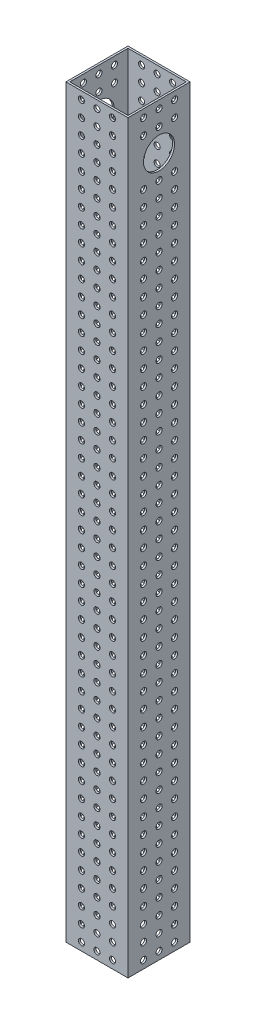
from build123d import *

# Parameters (mm, degrees)
SKETCH1_W           = 50.8
SKETCH1_H           = 50.8
SKETCH1_W_2         = 47.625
SKETCH1_H_2         = 47.625
BOSS_EXTRUDE1_DEPTH = 685.8
SKETCH2_R           = 2.4892
CUT_EXTRUDE1_DEPTH  = 689.147832955
SKETCH4_R           = 2.4892
CUT_EXTRUDE2_DEPTH  = 689.147832955
SKETCH5_W           = 50.8
SKETCH5_H           = 76.2
CUT_EXTRUDE3_DEPTH  = 689.147832955
SKETCH6_R           = 12.7
CUT_EXTRUDE4_DEPTH  = 613.240116294


with BuildPart() as part:
    # Sketch1 → Boss-Extrude1 (new body)
    with BuildSketch(Plane(origin=(0, 0, 0), x_dir=(1, 0, 0), z_dir=(0, 1, 0))):
        Rectangle(SKETCH1_W, SKETCH1_H)
        Rectangle(SKETCH1_W_2, SKETCH1_H_2, mode=Mode.SUBTRACT)
    extrude(amount=BOSS_EXTRUDE1_DEPTH)

    # Sketch2 → Cut-Extrude1 (cut, through all)
    with BuildSketch(Plane.XY.offset(25.4)):
        with Locations((-12.7, 679.45)):
            Circle(SKETCH2_R)
        with Locations((-12.7, 666.75)):
            Circle(SKETCH2_R)
        with Locations((-12.7, 654.05)):
            Circle(SKETCH2_R)
        with Locations((-12.7, 641.35)):
            Circle(SKETCH2_R)
        with Locations((-12.7, 628.65)):
            Circle(SKETCH2_R)
        with Locations((-12.7, 615.95)):
            Circle(SKETCH2_R)
        with Locations((-12.7, 603.25)):
            Circle(SKETCH2_R)
        with Locations((-12.7, 590.55)):
            Circle(SKETCH2_R)
        with Locations((-12.7, 577.85)):
            Circle(SKETCH2_R)
        with Locations((-12.7, 565.15)):
            Circle(SKETCH2_R)
        with Locations((-12.7, 552.45)):
            Circle(SKETCH2_R)
        with Locations((-12.7, 539.75)):
            Circle(SKETCH2_R)
        with Locations((-12.7, 527.05)):
            Circle(SKETCH2_R)
        with Locations((-12.7, 514.35)):
            Circle(SKETCH2_R)
        with Locations((-12.7, 501.65)):
            Circle(SKETCH2_R)
        with Locations((-12.7, 488.95)):
            Circle(SKETCH2_R)
        with Locations((-12.7, 476.25)):
            Circle(SKETCH2_R)
        with Locations((-12.7, 463.55)):
            Circle(SKETCH2_R)
        with Locations((-12.7, 450.85)):
            Circle(SKETCH2_R)
        with Locations((-12.7, 438.15)):
            Circle(SKETCH2_R)
        with Locations((-12.7, 425.45)):
            Circle(SKETCH2_R)
        with Locations((-12.7, 412.75)):
            Circle(SKETCH2_R)
        with Locations((-12.7, 400.05)):
            Circle(SKETCH2_R)
        with Locations((-12.7, 387.35)):
            Circle(SKETCH2_R)
        with Locations((-12.7, 374.65)):
            Circle(SKETCH2_R)
        with Locations((-12.7, 361.95)):
            Circle(SKETCH2_R)
        with Locations((-12.7, 349.25)):
            Circle(SKETCH2_R)
        with Locations((-12.7, 336.55)):
            Circle(SKETCH2_R)
        with Locations((-12.7, 323.85)):
            Circle(SKETCH2_R)
        with Locations((-12.7, 311.15)):
            Circle(SKETCH2_R)
        with Locations((-12.7, 298.45)):
            Circle(SKETCH2_R)
        with Locations((-12.7, 285.75)):
            Circle(SKETCH2_R)
        with Locations((-12.7, 273.05)):
            Circle(SKETCH2_R)
        with Locations((-12.7, 260.35)):
            Circle(SKETCH2_R)
        with Locations((-12.7, 247.65)):
            Circle(SKETCH2_R)
        with Locations((-12.7, 234.95)):
            Circle(SKETCH2_R)
        with Locations((-12.7, 222.25)):
            Circle(SKETCH2_R)
        with Locations((-12.7, 209.55)):
            Circle(SKETCH2_R)
        with Locations((-12.7, 196.85)):
            Circle(SKETCH2_R)
        with Locations((-12.7, 184.15)):
            Circle(SKETCH2_R)
        with Locations((-12.7, 171.45)):
            Circle(SKETCH2_R)
        with Locations((-12.7, 158.75)):
            Circle(SKETCH2_R)
        with Locations((-12.7, 146.05)):
            Circle(SKETCH2_R)
        with Locations((-12.7, 133.35)):
            Circle(SKETCH2_R)
        with Locations((-12.7, 120.65)):
            Circle(SKETCH2_R)
        with Locations((-12.7, 107.95)):
            Circle(SKETCH2_R)
        with Locations((-12.7, 95.25)):
            Circle(SKETCH2_R)
        with Locations((-12.7, 82.55)):
            Circle(SKETCH2_R)
        with Locations((-12.7, 69.85)):
            Circle(SKETCH2_R)
        with Locations((-12.7, 57.15)):
            Circle(SKETCH2_R)
        with Locations((-12.7, 44.45)):
            Circle(SKETCH2_R)
        with Locations((-12.7, 31.75)):
            Circle(SKETCH2_R)
        with Locations((-12.7, 19.05)):
            Circle(SKETCH2_R)
        with Locations((-12.7, 6.35)):
            Circle(SKETCH2_R)
        with Locations((12.7, 6.35)):
            Circle(SKETCH2_R)
        with Locations((12.7, 19.05)):
            Circle(SKETCH2_R)
        with Locations((12.7, 31.75)):
            Circle(SKETCH2_R)
        with Locations((12.7, 44.45)):
            Circle(SKETCH2_R)
        with Locations((12.7, 57.15)):
            Circle(SKETCH2_R)
        with Locations((12.7, 69.85)):
            Circle(SKETCH2_R)
        with Locations((12.7, 82.55)):
            Circle(SKETCH2_R)
        with Locations((12.7, 95.25)):
            Circle(SKETCH2_R)
        with Locations((12.7, 107.95)):
            Circle(SKETCH2_R)
        with Locations((12.7, 120.65)):
            Circle(SKETCH2_R)
        with Locations((12.7, 133.35)):
            Circle(SKETCH2_R)
        with Locations((12.7, 146.05)):
            Circle(SKETCH2_R)
        with Locations((12.7, 158.75)):
            Circle(SKETCH2_R)
        with Locations((12.7, 171.45)):
            Circle(SKETCH2_R)
        with Locations((12.7, 184.15)):
            Circle(SKETCH2_R)
        with Locations((12.7, 196.85)):
            Circle(SKETCH2_R)
        with Locations((12.7, 209.55)):
            Circle(SKETCH2_R)
        with Locations((12.7, 222.25)):
            Circle(SKETCH2_R)
        with Locations((12.7, 234.95)):
            Circle(SKETCH2_R)
        with Locations((12.7, 247.65)):
            Circle(SKETCH2_R)
        with Locations((12.7, 260.35)):
            Circle(SKETCH2_R)
        with Locations((12.7, 273.05)):
            Circle(SKETCH2_R)
        with Locations((12.7, 285.75)):
            Circle(SKETCH2_R)
        with Locations((12.7, 298.45)):
            Circle(SKETCH2_R)
        with Locations((12.7, 311.15)):
            Circle(SKETCH2_R)
        with Locations((12.7, 323.85)):
            Circle(SKETCH2_R)
        with Locations((12.7, 336.55)):
            Circle(SKETCH2_R)
        with Locations((12.7, 374.65)):
            Circle(SKETCH2_R)
        with Locations((12.7, 361.95)):
            Circle(SKETCH2_R)
        with Locations((12.7, 349.25)):
            Circle(SKETCH2_R)
        with Locations((12.7, 387.35)):
            Circle(SKETCH2_R)
        with Locations((12.7, 400.05)):
            Circle(SKETCH2_R)
        with Locations((12.7, 412.75)):
            Circle(SKETCH2_R)
        with Locations((12.7, 425.45)):
            Circle(SKETCH2_R)
        with Locations((12.7, 438.15)):
            Circle(SKETCH2_R)
        with Locations((12.7, 450.85)):
            Circle(SKETCH2_R)
        with Locations((12.7, 463.55)):
            Circle(SKETCH2_R)
        with Locations((12.7, 476.25)):
            Circle(SKETCH2_R)
        with Locations((12.7, 488.95)):
            Circle(SKETCH2_R)
        with Locations((12.7, 501.65)):
            Circle(SKETCH2_R)
        with Locations((12.7, 514.35)):
            Circle(SKETCH2_R)
        with Locations((12.7, 527.05)):
            Circle(SKETCH2_R)
        with Locations((12.7, 539.75)):
            Circle(SKETCH2_R)
        with Locations((12.7, 552.45)):
            Circle(SKETCH2_R)
        with Locations((12.7, 565.15)):
            Circle(SKETCH2_R)
        with Locations((12.7, 577.85)):
            Circle(SKETCH2_R)
        with Locations((12.7, 590.55)):
            Circle(SKETCH2_R)
        with Locations((12.7, 603.25)):
            Circle(SKETCH2_R)
        with Locations((12.7, 615.95)):
            Circle(SKETCH2_R)
        with Locations((12.7, 628.65)):
            Circle(SKETCH2_R)
        with Locations((12.7, 641.35)):
            Circle(SKETCH2_R)
        with Locations((12.7, 654.05)):
            Circle(SKETCH2_R)
        with Locations((12.7, 666.75)):
            Circle(SKETCH2_R)
        with Locations((12.7, 679.45)):
            Circle(SKETCH2_R)
        with Locations((0, 6.35)):
            Circle(SKETCH2_R)
        with Locations((0, 19.05)):
            Circle(SKETCH2_R)
        with Locations((0, 31.75)):
            Circle(SKETCH2_R)
        with Locations((0, 44.45)):
            Circle(SKETCH2_R)
        with Locations((0, 57.15)):
            Circle(SKETCH2_R)
        with Locations((0, 69.85)):
            Circle(SKETCH2_R)
        with Locations((0, 82.55)):
            Circle(SKETCH2_R)
        with Locations((0, 95.25)):
            Circle(SKETCH2_R)
        with Locations((0, 107.95)):
            Circle(SKETCH2_R)
        with Locations((0, 120.65)):
            Circle(SKETCH2_R)
        with Locations((0, 133.35)):
            Circle(SKETCH2_R)
        with Locations((0, 146.05)):
            Circle(SKETCH2_R)
        with Locations((0, 158.75)):
            Circle(SKETCH2_R)
        with Locations((0, 171.45)):
            Circle(SKETCH2_R)
        with Locations((0, 184.15)):
            Circle(SKETCH2_R)
        with Locations((0, 196.85)):
            Circle(SKETCH2_R)
        with Locations((0, 209.55)):
            Circle(SKETCH2_R)
        with Locations((0, 222.25)):
            Circle(SKETCH2_R)
        with Locations((0, 234.95)):
            Circle(SKETCH2_R)
        with Locations((0, 247.65)):
            Circle(SKETCH2_R)
        with Locations((0, 260.35)):
            Circle(SKETCH2_R)
        with Locations((0, 273.05)):
            Circle(SKETCH2_R)
        with Locations((0, 285.75)):
            Circle(SKETCH2_R)
        with Locations((0, 298.45)):
            Circle(SKETCH2_R)
        with Locations((0, 311.15)):
            Circle(SKETCH2_R)
        with Locations((0, 323.85)):
            Circle(SKETCH2_R)
        with Locations((0, 336.55)):
            Circle(SKETCH2_R)
        with Locations((0, 349.25)):
            Circle(SKETCH2_R)
        with Locations((0, 361.95)):
            Circle(SKETCH2_R)
        with Locations((0, 374.65)):
            Circle(SKETCH2_R)
        with Locations((0, 387.35)):
            Circle(SKETCH2_R)
        with Locations((0, 400.05)):
            Circle(SKETCH2_R)
        with Locations((0, 412.75)):
            Circle(SKETCH2_R)
        with Locations((0, 425.45)):
            Circle(SKETCH2_R)
        with Locations((0, 438.15)):
            Circle(SKETCH2_R)
        with Locations((0, 450.85)):
            Circle(SKETCH2_R)
        with Locations((0, 463.55)):
            Circle(SKETCH2_R)
        with Locations((0, 476.25)):
            Circle(SKETCH2_R)
        with Locations((0, 488.95)):
            Circle(SKETCH2_R)
        with Locations((0, 501.65)):
            Circle(SKETCH2_R)
        with Locations((0, 514.35)):
            Circle(SKETCH2_R)
        with Locations((0, 527.05)):
            Circle(SKETCH2_R)
        with Locations((0, 539.75)):
            Circle(SKETCH2_R)
        with Locations((0, 552.45)):
            Circle(SKETCH2_R)
        with Locations((0, 565.15)):
            Circle(SKETCH2_R)
        with Locations((0, 577.85)):
            Circle(SKETCH2_R)
        with Locations((0, 590.55)):
            Circle(SKETCH2_R)
        with Locations((0, 603.25)):
            Circle(SKETCH2_R)
        with Locations((0, 615.95)):
            Circle(SKETCH2_R)
        with Locations((0, 628.65)):
            Circle(SKETCH2_R)
        with Locations((0, 641.35)):
            Circle(SKETCH2_R)
        with Locations((0, 654.05)):
            Circle(SKETCH2_R)
        with Locations((0, 666.75)):
            Circle(SKETCH2_R)
        with Locations((0, 679.45)):
            Circle(SKETCH2_R)
    extrude(amount=-CUT_EXTRUDE1_DEPTH, mode=Mode.SUBTRACT)

    # Sketch4 → Cut-Extrude2 (cut, through all)
    with BuildSketch(Plane(origin=(25.4, 0, 0), x_dir=(0, 0, -1), z_dir=(1, 0, 0))):
        with Locations((-12.7, 679.45)):
            Circle(SKETCH4_R)
        with Locations((-12.7, 666.75)):
            Circle(SKETCH4_R)
        with Locations((-12.7, 654.05)):
            Circle(SKETCH4_R)
        with Locations((-12.7, 641.35)):
            Circle(SKETCH4_R)
        with Locations((-12.7, 628.65)):
            Circle(SKETCH4_R)
        with Locations((-12.7, 615.95)):
            Circle(SKETCH4_R)
        with Locations((-12.7, 603.25)):
            Circle(SKETCH4_R)
        with Locations((-12.7, 590.55)):
            Circle(SKETCH4_R)
        with Locations((-12.7, 552.45)):
            Circle(SKETCH4_R)
        with Locations((-12.7, 539.75)):
            Circle(SKETCH4_R)
        with Locations((-12.7, 527.05)):
            Circle(SKETCH4_R)
        with Locations((-12.7, 514.35)):
            Circle(SKETCH4_R)
        with Locations((-12.7, 501.65)):
            Circle(SKETCH4_R)
        with Locations((-12.7, 488.95)):
            Circle(SKETCH4_R)
        with Locations((-12.7, 476.25)):
            Circle(SKETCH4_R)
        with Locations((-12.7, 463.55)):
            Circle(SKETCH4_R)
        with Locations((-12.7, 450.85)):
            Circle(SKETCH4_R)
        with Locations((-12.7, 438.15)):
            Circle(SKETCH4_R)
        with Locations((-12.7, 425.45)):
            Circle(SKETCH4_R)
        with Locations((-12.7, 412.75)):
            Circle(SKETCH4_R)
        with Locations((-12.7, 400.05)):
            Circle(SKETCH4_R)
        with Locations((-12.7, 387.35)):
            Circle(SKETCH4_R)
        with Locations((-12.7, 374.65)):
            Circle(SKETCH4_R)
        with Locations((-12.7, 361.95)):
            Circle(SKETCH4_R)
        with Locations((-12.7, 349.25)):
            Circle(SKETCH4_R)
        with Locations((-12.7, 336.55)):
            Circle(SKETCH4_R)
        with Locations((-12.7, 323.85)):
            Circle(SKETCH4_R)
        with Locations((-12.7, 311.15)):
            Circle(SKETCH4_R)
        with Locations((-12.7, 298.45)):
            Circle(SKETCH4_R)
        with Locations((-12.7, 285.75)):
            Circle(SKETCH4_R)
        with Locations((-12.7, 273.05)):
            Circle(SKETCH4_R)
        with Locations((-12.7, 260.35)):
            Circle(SKETCH4_R)
        with Locations((-12.7, 247.65)):
            Circle(SKETCH4_R)
        with Locations((-12.7, 234.95)):
            Circle(SKETCH4_R)
        with Locations((-12.7, 222.25)):
            Circle(SKETCH4_R)
        with Locations((-12.7, 209.55)):
            Circle(SKETCH4_R)
        with Locations((-12.7, 196.85)):
            Circle(SKETCH4_R)
        with Locations((-12.7, 184.15)):
            Circle(SKETCH4_R)
        with Locations((-12.7, 171.45)):
            Circle(SKETCH4_R)
        with Locations((-12.7, 158.75)):
            Circle(SKETCH4_R)
        with Locations((-12.7, 146.05)):
            Circle(SKETCH4_R)
        with Locations((-12.7, 133.35)):
            Circle(SKETCH4_R)
        with Locations((-12.7, 120.65)):
            Circle(SKETCH4_R)
        with Locations((-12.7, 107.95)):
            Circle(SKETCH4_R)
        with Locations((-12.7, 95.25)):
            Circle(SKETCH4_R)
        with Locations((-12.7, 82.55)):
            Circle(SKETCH4_R)
        with Locations((-12.7, 69.85)):
            Circle(SKETCH4_R)
        with Locations((-12.7, 57.15)):
            Circle(SKETCH4_R)
        with Locations((-12.7, 44.45)):
            Circle(SKETCH4_R)
        with Locations((-12.7, 31.75)):
            Circle(SKETCH4_R)
        with Locations((-12.7, 19.05)):
            Circle(SKETCH4_R)
        with Locations((-12.7, 6.35)):
            Circle(SKETCH4_R)
        with Locations((12.7, 273.05)):
            Circle(SKETCH4_R)
        with Locations((12.7, 285.75)):
            Circle(SKETCH4_R)
        with Locations((12.7, 298.45)):
            Circle(SKETCH4_R)
        with Locations((12.7, 311.15)):
            Circle(SKETCH4_R)
        with Locations((12.7, 323.85)):
            Circle(SKETCH4_R)
        with Locations((12.7, 336.55)):
            Circle(SKETCH4_R)
        with Locations((12.7, 349.25)):
            Circle(SKETCH4_R)
        with Locations((12.7, 361.95)):
            Circle(SKETCH4_R)
        with Locations((12.7, 374.65)):
            Circle(SKETCH4_R)
        with Locations((12.7, 387.35)):
            Circle(SKETCH4_R)
        with Locations((12.7, 400.05)):
            Circle(SKETCH4_R)
        with Locations((12.7, 412.75)):
            Circle(SKETCH4_R)
        with Locations((12.7, 425.45)):
            Circle(SKETCH4_R)
        with Locations((12.7, 438.15)):
            Circle(SKETCH4_R)
        with Locations((12.7, 450.85)):
            Circle(SKETCH4_R)
        with Locations((12.7, 463.55)):
            Circle(SKETCH4_R)
        with Locations((12.7, 476.25)):
            Circle(SKETCH4_R)
        with Locations((12.7, 488.95)):
            Circle(SKETCH4_R)
        with Locations((12.7, 501.65)):
            Circle(SKETCH4_R)
        with Locations((12.7, 514.35)):
            Circle(SKETCH4_R)
        with Locations((12.7, 527.05)):
            Circle(SKETCH4_R)
        with Locations((12.7, 539.75)):
            Circle(SKETCH4_R)
        with Locations((12.7, 552.45)):
            Circle(SKETCH4_R)
        with Locations((12.7, 590.55)):
            Circle(SKETCH4_R)
        with Locations((12.7, 603.25)):
            Circle(SKETCH4_R)
        with Locations((12.7, 615.95)):
            Circle(SKETCH4_R)
        with Locations((12.7, 628.65)):
            Circle(SKETCH4_R)
        with Locations((12.7, 641.35)):
            Circle(SKETCH4_R)
        with Locations((12.7, 654.05)):
            Circle(SKETCH4_R)
        with Locations((12.7, 666.75)):
            Circle(SKETCH4_R)
        with Locations((12.7, 19.05)):
            Circle(SKETCH4_R)
        with Locations((12.7, 31.75)):
            Circle(SKETCH4_R)
        with Locations((12.7, 44.45)):
            Circle(SKETCH4_R)
        with Locations((12.7, 57.15)):
            Circle(SKETCH4_R)
        with Locations((12.7, 69.85)):
            Circle(SKETCH4_R)
        with Locations((12.7, 82.55)):
            Circle(SKETCH4_R)
        with Locations((12.7, 95.25)):
            Circle(SKETCH4_R)
        with Locations((12.7, 107.95)):
            Circle(SKETCH4_R)
        with Locations((12.7, 120.65)):
            Circle(SKETCH4_R)
        with Locations((12.7, 133.35)):
            Circle(SKETCH4_R)
        with Locations((12.7, 146.05)):
            Circle(SKETCH4_R)
        with Locations((12.7, 158.75)):
            Circle(SKETCH4_R)
        with Locations((12.7, 171.45)):
            Circle(SKETCH4_R)
        with Locations((12.7, 184.15)):
            Circle(SKETCH4_R)
        with Locations((12.7, 196.85)):
            Circle(SKETCH4_R)
        with Locations((12.7, 209.55)):
            Circle(SKETCH4_R)
        with Locations((12.7, 222.25)):
            Circle(SKETCH4_R)
        with Locations((12.7, 234.95)):
            Circle(SKETCH4_R)
        with Locations((12.7, 247.65)):
            Circle(SKETCH4_R)
        with Locations((12.7, 260.35)):
            Circle(SKETCH4_R)
        with Locations((12.7, 6.35)):
            Circle(SKETCH4_R)
        with Locations((12.7, 679.45)):
            Circle(SKETCH4_R)
        with Locations((0, 6.35)):
            Circle(SKETCH4_R)
        with Locations((0, 19.05)):
            Circle(SKETCH4_R)
        with Locations((0, 31.75)):
            Circle(SKETCH4_R)
        with Locations((0, 44.45)):
            Circle(SKETCH4_R)
        with Locations((0, 57.15)):
            Circle(SKETCH4_R)
        with Locations((0, 69.85)):
            Circle(SKETCH4_R)
        with Locations((0, 82.55)):
            Circle(SKETCH4_R)
        with Locations((0, 95.25)):
            Circle(SKETCH4_R)
        with Locations((0, 107.95)):
            Circle(SKETCH4_R)
        with Locations((0, 120.65)):
            Circle(SKETCH4_R)
        with Locations((0, 133.35)):
            Circle(SKETCH4_R)
        with Locations((0, 146.05)):
            Circle(SKETCH4_R)
        with Locations((0, 158.75)):
            Circle(SKETCH4_R)
        with Locations((0, 171.45)):
            Circle(SKETCH4_R)
        with Locations((0, 184.15)):
            Circle(SKETCH4_R)
        with Locations((0, 196.85)):
            Circle(SKETCH4_R)
        with Locations((0, 209.55)):
            Circle(SKETCH4_R)
        with Locations((0, 222.25)):
            Circle(SKETCH4_R)
        with Locations((0, 234.95)):
            Circle(SKETCH4_R)
        with Locations((0, 247.65)):
            Circle(SKETCH4_R)
        with Locations((0, 260.35)):
            Circle(SKETCH4_R)
        with Locations((0, 273.05)):
            Circle(SKETCH4_R)
        with Locations((0, 285.75)):
            Circle(SKETCH4_R)
        with Locations((0, 298.45)):
            Circle(SKETCH4_R)
        with Locations((0, 311.15)):
            Circle(SKETCH4_R)
        with Locations((0, 323.85)):
            Circle(SKETCH4_R)
        with Locations((0, 336.55)):
            Circle(SKETCH4_R)
        with Locations((0, 349.25)):
            Circle(SKETCH4_R)
        with Locations((0, 361.95)):
            Circle(SKETCH4_R)
        with Locations((0, 374.65)):
            Circle(SKETCH4_R)
        with Locations((0, 387.35)):
            Circle(SKETCH4_R)
        with Locations((0, 400.05)):
            Circle(SKETCH4_R)
        with Locations((0, 412.75)):
            Circle(SKETCH4_R)
        with Locations((0, 425.45)):
            Circle(SKETCH4_R)
        with Locations((0, 438.15)):
            Circle(SKETCH4_R)
        with Locations((0, 450.85)):
            Circle(SKETCH4_R)
        with Locations((0, 463.55)):
            Circle(SKETCH4_R)
        with Locations((0, 476.25)):
            Circle(SKETCH4_R)
        with Locations((0, 488.95)):
            Circle(SKETCH4_R)
        with Locations((0, 501.65)):
            Circle(SKETCH4_R)
        with Locations((0, 514.35)):
            Circle(SKETCH4_R)
        with Locations((0, 527.05)):
            Circle(SKETCH4_R)
        with Locations((0, 539.75)):
            Circle(SKETCH4_R)
        with Locations((0, 552.45)):
            Circle(SKETCH4_R)
        with Locations((0, 590.55)):
            Circle(SKETCH4_R)
        with Locations((0, 603.25)):
            Circle(SKETCH4_R)
        with Locations((0, 615.95)):
            Circle(SKETCH4_R)
        with Locations((0, 628.65)):
            Circle(SKETCH4_R)
        with Locations((0, 641.35)):
            Circle(SKETCH4_R)
        with Locations((0, 654.05)):
            Circle(SKETCH4_R)
        with Locations((0, 666.75)):
            Circle(SKETCH4_R)
        with Locations((0, 679.45)):
            Circle(SKETCH4_R)
    extrude(amount=-CUT_EXTRUDE2_DEPTH, mode=Mode.SUBTRACT)

    # Sketch5 → Cut-Extrude3 (cut, through all)
    with BuildSketch(Plane(origin=(25.4, 0, 0), x_dir=(0, 0, -1), z_dir=(1, 0, 0))):
        with Locations((0, 647.7)):
            Rectangle(SKETCH5_W, SKETCH5_H)
    extrude(amount=-CUT_EXTRUDE3_DEPTH, mode=Mode.SUBTRACT)

    # Sketch6 → Cut-Extrude4 (cut, through all)
    with BuildSketch(Plane(origin=(25.4, 0, 0), x_dir=(0, 0, -1), z_dir=(1, 0, 0))):
        with Locations((0, 571.9064)):
            Circle(SKETCH6_R)
    extrude(amount=-CUT_EXTRUDE4_DEPTH, mode=Mode.SUBTRACT)


solid = part.part
